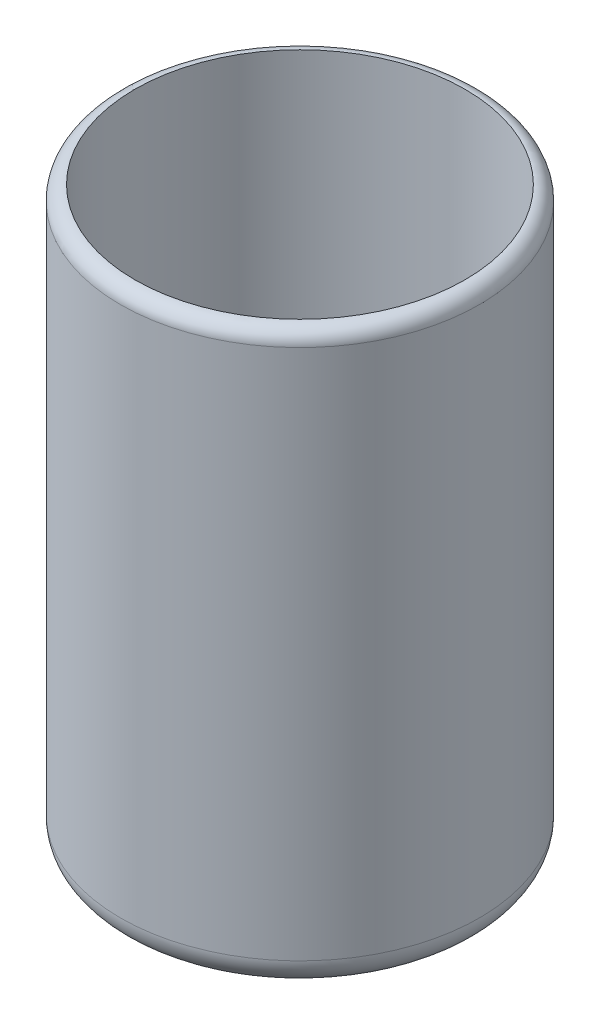
from build123d import *

# Parameters (mm, degrees)
SKETCH1_R           = 12.5
BOSS_EXTRUDE1_DEPTH = 40
SHELL1_T            = -1
FILLET1_R           = 2
FILLET7_R           = 1


with BuildPart() as part:
    # Sketch1 → Boss-Extrude1 (new body)
    with BuildSketch(Plane(origin=(0, 0, 0), x_dir=(1, 0, 0), z_dir=(0, 1, 0))):
        with Locations(Location((0, 0, 0), (0, 0, 270))):
            Circle(SKETCH1_R)
    extrude(amount=BOSS_EXTRUDE1_DEPTH)

    # Shell1
    shell1_openings = [part.faces().sort_by_distance(p)[0] for p in [
        (0, 40, 0),
    ]]
    offset(amount=SHELL1_T, openings=shell1_openings, kind=Kind.INTERSECTION)

    # Fillet1
    fillet1_edges = [part.edges().sort_by_distance(p)[0] for p in [
        (0, 0, -12.5),
    ]]
    fillet(fillet1_edges, radius=FILLET1_R)

    # Fillet7
    fillet7_edges = [part.edges().sort_by_distance(p)[0] for p in [
        (0, 40, -12.5),
    ]]
    fillet(fillet7_edges, radius=FILLET7_R - 0.0001)  # a hair under: the kernel refuses the full size


solid = part.part
